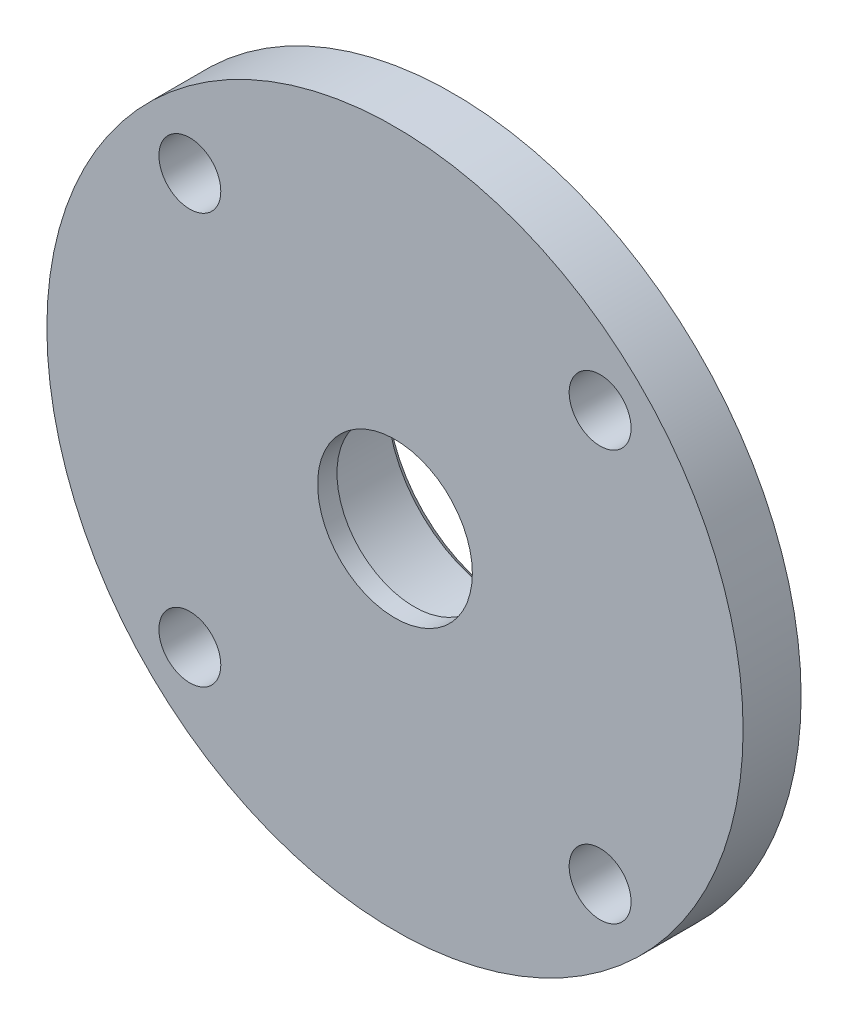
from build123d import *

# Parameters (mm, degrees)
CUT_EXTRUDE_1_REACH      = 28.153
SKETCH_2_R               = 1.6
PATTERN_CIRCULAR_1_COUNT = 4
CHAMFER_1_SIZE           = 0.4


with BuildPart() as part:
    # Эскиз1 → Повернуть1 (revolve)
    with BuildSketch(Plane(origin=(0, 0, 0), x_dir=(1, 0, 0), z_dir=(0, 1, 0))):
        Polygon((-4, 0), (-18, 0), (-18, 3), (-9.5, 3), (-9.5, 6), (-6, 6), (-6, 1), (-4, 1), align=None)
    revolve(axis=Axis((0, 0, 0), (0, 0, -1)))

    # Эскиз2 → Вырез-Вытянуть1 (cut, up to next)
    with BuildSketch(Plane.XY, mode=Mode.PRIVATE) as cut_extrude_1_sk1:
        with Locations((10.606601718, 10.606601718)):
            Circle(SKETCH_2_R)
    cut_extrude_1_tool1 = extrude(cut_extrude_1_sk1.sketch, amount=-CUT_EXTRUDE_1_REACH, mode=Mode.PRIVATE) & part.part
    cut_extrude_1 = cut_extrude_1_tool1.solids().sort_by_distance((10.606602, 10.606602, 0))[0]
    add(cut_extrude_1, mode=Mode.SUBTRACT)

    # Круговой массив1: Вырез-Вытянуть1 ×4 about axis
    pattern_circular_1_axis = Axis((0, 0, 0), (0, 0, 1))
    for i in range(1, PATTERN_CIRCULAR_1_COUNT):
        add(cut_extrude_1.rotate(pattern_circular_1_axis, i * 360 / PATTERN_CIRCULAR_1_COUNT), mode=Mode.SUBTRACT)

    # Фаска1
    chamfer_1_edges = [part.edges().sort_by_distance(p)[0] for p in [
        (6, 0, -6),
        (9.5, 0, -6),
    ]]
    chamfer(chamfer_1_edges, length=CHAMFER_1_SIZE)


solid = part.part
